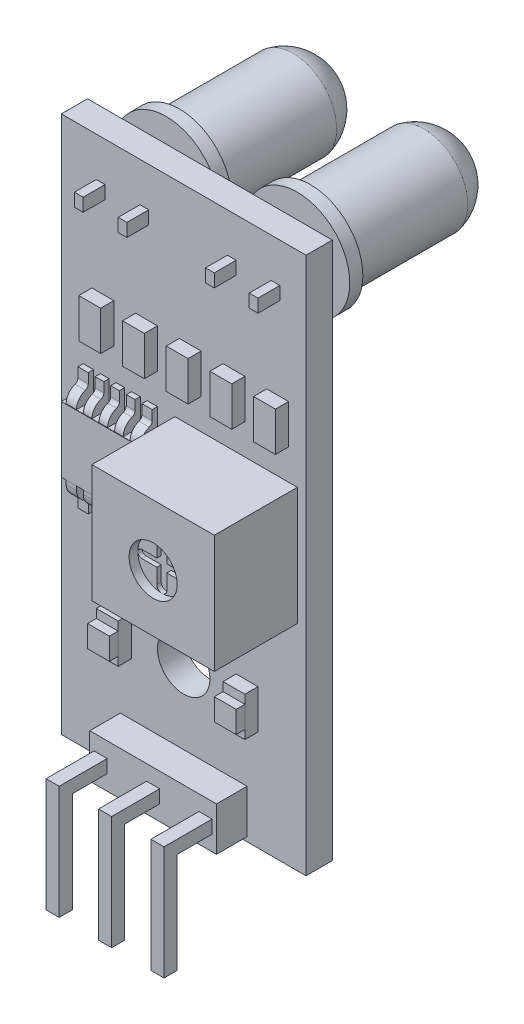
from build123d import *

# Parameters (mm, degrees)
SKETCH1_W                 = 14.224
SKETCH1_H                 = 31.242
BOSS_EXTRUDE1_DEPTH       = 0.762
SKETCH2_W                 = 7.366
SKETCH2_H                 = 2.54
BOSS_EXTRUDE2_DEPTH       = 1.778
BOSS_EXTRUDE3_START       = -4.318
SKETCH5_W                 = 0.762
SKETCH5_H                 = 0.762
BOSS_EXTRUDE3_DEPTH       = 6.35
SKETCH6_W                 = 0.762
SKETCH6_H                 = 0.762
BOSS_EXTRUDE4_DEPTH       = 6.604
LPATTERN1_COUNT           = 3
LPATTERN1_PITCH           = 3.048
CUT_EXTRUDE2_DEPTH        = 23.008773887
CUT_EXTRUDE2_DEPTH_BACK   = 23.008773887
SKETCH8_R                 = 1.524
SKETCH9_W                 = 1.27
SKETCH9_H                 = 2.286
BOSS_EXTRUDE5_DEPTH       = 0.762
SKETCH10_W                = 1.27
SKETCH10_H                = 1.27
BOSS_EXTRUDE6_DEPTH       = 0.508
LPATTERN2_START           = 3.048
LPATTERN2_OUTLINE_W       = 1.27
LPATTERN2_OUTLINE_H       = 0.508
LPATTERN2_DEPTH           = 1.27
LPATTERN2_START_2         = -9.779
LPATTERN2_2_OUTLINE_W     = 1.27
LPATTERN2_2_OUTLINE_H     = 0.762
LPATTERN2_2_DEPTH         = 2.286
SKETCH12_W                = 2.286
SKETCH12_H                = 1.27
BOSS_EXTRUDE7_DEPTH       = 0.762
LPATTERN3_COUNT           = 2
LPATTERN3_PITCH           = 5.842
SKETCH16_W                = 7.112
SKETCH16_H                = 6.858
BOSS_EXTRUDE9_DEPTH       = 4.826
SKETCH17_R                = 1.397
CUT_EXTRUDE3_DEPTH        = 0.508
CUT_EXTRUDE4_DEPTH        = 0.254
SKETCH19_W                = 1.27
SKETCH19_H                = 2.286
BOSS_EXTRUDE10_DEPTH      = 0.762
LPATTERN4_COUNT           = 5
LPATTERN4_PITCH           = 2.54
SKETCH31_W                = 4.826
SKETCH31_H                = 3.81
BOSS_EXTRUDE14_DEPTH      = 1.016
SKETCH32_W                = 4.318
SKETCH32_H                = 7.112
BOSS_EXTRUDE15_DEPTH      = 0.9906
SKETCH33_W                = 4.318
SKETCH33_H                = 0.762
CUT_EXTRUDE5_DEPTH        = 0.6858
FILLET4_R                 = 0.762
FILLET5_R                 = 0.254
BOSS_EXTRUDE16_START      = -2.54
SKETCH20_W                = 0.508
SKETCH20_H                = 0.762
BOSS_EXTRUDE16_DEPTH      = 3.81
LPATTERN6_COUNT           = 2
LPATTERN6_PITCH           = 2.54
LPATTERN9_COUNT           = 2
LPATTERN9_PITCH           = 7.62
LPATTERN9_START           = -2.54
LPATTERN9_COPY_1_SKETCH_W = 0.508
LPATTERN9_COPY_1_SKETCH_H = 0.762
LPATTERN9_COPY_1_DEPTH    = 3.81
CUT_EXTRUDE6_START        = -1.016
SKETCH38_W                = 0.4
SKETCH38_H                = 2.458537154
CUT_EXTRUDE6_DEPTH        = 0.9906


# Read off the part's stored shape, not the designer's step: LPattern2
with BuildPart() as part:
    # Sketch1 → Boss-Extrude1 (new, symmetric)
    with BuildSketch(Plane.XY):
        Rectangle(SKETCH1_W, SKETCH1_H)
    extrude(amount=BOSS_EXTRUDE1_DEPTH, both=True)

    # Sketch2 → Boss-Extrude2 (add)
    with BuildSketch(Plane.XY.offset(0.762)):
        with Locations((0, -14.097)):
            Rectangle(SKETCH2_W, SKETCH2_H)
    extrude(amount=BOSS_EXTRUDE2_DEPTH)

    # Sketch5 → Boss-Extrude3 (add)
    with BuildSketch(Plane.XY.offset(2.54).offset(BOSS_EXTRUDE3_START)):
        with Locations((-3.048, -14.097)):
            Rectangle(SKETCH5_W, SKETCH5_H)
    boss_extrude3 = extrude(amount=BOSS_EXTRUDE3_DEPTH)

    # Sketch6 → Boss-Extrude4 (add)
    with BuildSketch(Plane(origin=(0, -13.716, 0), x_dir=(1, 0, 0), z_dir=(0, 1, 0))):
        with Locations((-3.048, -4.953)):
            Rectangle(SKETCH6_W, SKETCH6_H)
    boss_extrude4 = extrude(amount=-BOSS_EXTRUDE4_DEPTH)

    # LPattern1: Boss-Extrude3, Boss-Extrude4 ×3
    with Locations(*[(i * LPATTERN1_PITCH, 0, 0) for i in range(1, LPATTERN1_COUNT)]):
        add(boss_extrude3)
        add(boss_extrude4)

    # Sketch8 → Cut-Extrude2 (cut, two sides: drawn at the far end of the back side and taken through both)
    with BuildSketch(Plane.XY.offset(0.762).offset(-CUT_EXTRUDE2_DEPTH_BACK)):
        with Locations(Location((0, -8.509, 0), (0, 0, 180))):
            Circle(SKETCH8_R)
    extrude(amount=CUT_EXTRUDE2_DEPTH + CUT_EXTRUDE2_DEPTH_BACK, mode=Mode.SUBTRACT)

    # Sketch9 → Boss-Extrude5 (add)
    with BuildSketch(Plane.XY.offset(0.762)):
        with Locations((-3.683, -8.636)):
            Rectangle(SKETCH9_W, SKETCH9_H)
    extrude(amount=BOSS_EXTRUDE5_DEPTH)

    # LPattern2 2 outline → LPattern2 2 (add)
    with BuildSketch(Plane(origin=(0, 0, 0), x_dir=(1, 0, 0), z_dir=(0, 1, 0)).offset(LPATTERN2_START_2)):
        with Locations((3.683, -1.143)):
            Rectangle(LPATTERN2_2_OUTLINE_W, LPATTERN2_2_OUTLINE_H)
    extrude(amount=LPATTERN2_2_DEPTH)

    # Sketch12 → Boss-Extrude7 (add)
    with BuildSketch(Plane.XY.offset(0.762)):
        with Locations((-2.921, -4.826)):
            Rectangle(SKETCH12_W, SKETCH12_H)
    boss_extrude7 = extrude(amount=BOSS_EXTRUDE7_DEPTH)

    # LPattern3: Boss-Extrude7 ×2
    with Locations(*[(i * LPATTERN3_PITCH, 0, 0) for i in range(1, LPATTERN3_COUNT)]):
        add(boss_extrude7)

    # Sketch16 → Boss-Extrude9 (add)
    with BuildSketch(Plane.XY.offset(0.762)):
        with Locations((3.048, 0.254)):
            Rectangle(SKETCH16_W, SKETCH16_H)
    extrude(amount=BOSS_EXTRUDE9_DEPTH)

    # Sketch17 → Cut-Extrude3 (cut)
    with BuildSketch(Plane.XY.offset(5.588)):
        with Locations((3.048, 0.127)):
            Circle(SKETCH17_R)
    extrude(amount=-CUT_EXTRUDE3_DEPTH, mode=Mode.SUBTRACT)

    # Sketch18 → Cut-Extrude4 (cut)
    with BuildSketch(Plane.XY.offset(5.08)):
        with BuildLine():
            Line((2.757000791, -0.979000791), (2.757000791, -0.102851416))
            Line((2.757000791, -0.102851416), (1.880851416, -0.102851416))
            ThreePointArc((1.880851416, -0.102851416), (1.651, 0.127), (1.880851416, 0.356851416))
            Line((1.880851416, 0.356851416), (2.757000791, 0.356851416))
            Line((2.757000791, 0.356851416), (2.757000791, 1.233000791))
            ThreePointArc((2.757000791, 1.233000791), (3.048, 1.524), (3.338999209, 1.233000791))
            Line((3.338999209, 1.233000791), (3.338999209, 0.356851416))
            Line((3.338999209, 0.356851416), (4.215148584, 0.356851416))
            ThreePointArc((4.215148584, 0.356851416), (4.445, 0.127), (4.215148584, -0.102851416))
            Line((4.215148584, -0.102851416), (3.338999209, -0.102851416))
            Line((3.338999209, -0.102851416), (3.338999209, -0.979000791))
            ThreePointArc((3.338999209, -0.979000791), (3.048, -1.27), (2.757000791, -0.979000791))
        make_face()
    extrude(amount=-CUT_EXTRUDE4_DEPTH, mode=Mode.SUBTRACT)

    # Sketch19 → Boss-Extrude10 (add)
    with BuildSketch(Plane.XY.offset(0.762)):
        with Locations((5.461, 6.604)):
            Rectangle(SKETCH19_W, SKETCH19_H)
    boss_extrude10 = extrude(amount=BOSS_EXTRUDE10_DEPTH)

    # LPattern4: Boss-Extrude10 ×5
    with Locations(*[(-i * LPATTERN4_PITCH, 0, 0) for i in range(1, LPATTERN4_COUNT)]):
        add(boss_extrude10)

    # Sketch31 → Boss-Extrude14 (add)
    with BuildSketch(Plane.XY.offset(0.762)):
        with Locations((-3.683, 0.254)):
            Rectangle(SKETCH31_W, SKETCH31_H)
    extrude(amount=BOSS_EXTRUDE14_DEPTH)

    # Sketch32 → Boss-Extrude15 (add)
    with BuildSketch(Plane.XY.offset(0.762)):
        with Locations((-3.683, 0.127)):
            Rectangle(SKETCH32_W, SKETCH32_H)
    extrude(amount=BOSS_EXTRUDE15_DEPTH)

    # Sketch33 → Cut-Extrude5 (cut)
    with BuildSketch(Plane.XY.offset(1.7526)):
        with Locations((-3.683, -3.048)):
            Rectangle(SKETCH33_W, SKETCH33_H)
        with Locations((-3.683, 3.302)):
            Rectangle(SKETCH33_W, SKETCH33_H)
    extrude(amount=-CUT_EXTRUDE5_DEPTH, mode=Mode.SUBTRACT)

    # Fillet4
    # the kernel refuses this fillet: 0.762 mm, written as the material it takes off along each edge
    with BuildSketch(Plane(origin=(0.371451068, 2.921, 1.7526), x_dir=(0, -1, 0), z_dir=(-1, 0, 0))) as fillet4_piece_1_section:
        with BuildLine():
            CenterArc((0.758180427, -0.762), FILLET4_R, 90, 84.260829523)
            Line((0, -0.6858), (0, 0))
            Line((0, 0), (0.758180427, 0))
        make_face()
    fillet4_piece_1 = extrude(amount=8.108902135, mode=Mode.PRIVATE)
    fillet4_piece_1 = split(fillet4_piece_1, bisect_by=Plane(origin=(-0.508, 2.675007043, 1.556844553), z_dir=(-1, 0, 0)), keep=Keep.TOP, mode=Mode.PRIVATE)
    add(fillet4_piece_1, mode=Mode.SUBTRACT)
    with BuildSketch(Plane(origin=(0.371451068, -2.667, 1.7526), x_dir=(0, 1, 0), z_dir=(-1, 0, 0))) as fillet4_piece_2_section:
        with BuildLine():
            CenterArc((0.758180427, 0.762), FILLET4_R, 185.739170477, 84.260829523)
            Line((0, 0.6858), (0, 0))
            Line((0, 0), (0.758180427, 0))
        make_face()
    fillet4_piece_2 = extrude(amount=8.108902135, mode=Mode.PRIVATE)
    fillet4_piece_2 = split(fillet4_piece_2, bisect_by=Plane(origin=(-0.508, -2.421007043, 1.556844553), z_dir=(-1, 0, 0)), keep=Keep.TOP, mode=Mode.PRIVATE)
    add(fillet4_piece_2, mode=Mode.SUBTRACT)

    # Fillet5
    fillet5_edges = [part.edges().sort_by_distance(p)[0] for p in [
        (-3.683, -2.667, 1.0668),
        (-3.683, 2.921, 1.0668),
    ]]
    fillet(fillet5_edges, radius=FILLET5_R)

    # Sketch20 → Boss-Extrude16 (add)
    with BuildSketch(Plane.XY.offset(0.762).offset(BOSS_EXTRUDE16_START)):
        with Locations((5.334, 12.954)):
            Rectangle(SKETCH20_W, SKETCH20_H)
    boss_extrude16 = extrude(amount=BOSS_EXTRUDE16_DEPTH)

    # LPattern6: Boss-Extrude16 ×2
    with Locations(*[(-i * LPATTERN6_PITCH, 0, 0) for i in range(1, LPATTERN6_COUNT)]):
        add(boss_extrude16)

    # Sketch37 → Revolve4 (revolve)
    with BuildSketch(Plane(origin=(0, 12.954, 0), x_dir=(1, 0, 0), z_dir=(0, 1, 0))):
        with BuildLine():
            Line((4.064, 1.778), (4.064, 11.176))
            ThreePointArc((4.064, 11.176), (5.701938499, 10.619923124), (6.604, 9.144))
            Line((6.604, 9.144), (6.604, 2.54))
            Line((6.604, 2.54), (7.112, 2.54))
            Line((7.112, 2.54), (7.112, 1.778))
            Line((7.112, 1.778), (4.064, 1.778))
        make_face()
    revolve4 = revolve(axis=Axis((4.064, 12.954, -1.778), (0, 0, -1)))

    # LPattern9: Boss-Extrude16, Revolve4 ×2
    with Locations(*[(-i * LPATTERN9_PITCH, 0, 0) for i in range(1, LPATTERN9_COUNT)]):
        add(boss_extrude16)
        add(revolve4)

    # LPattern9 copy 1 sketch → LPattern9 copy 1 (add)
    with BuildSketch(Plane(origin=(-10.16, 0, 0.762), x_dir=(1, 0, 0), z_dir=(0, 0, 1)).offset(LPATTERN9_START)):
        with Locations((5.334, 12.954)):
            Rectangle(LPATTERN9_COPY_1_SKETCH_W, LPATTERN9_COPY_1_SKETCH_H)
    extrude(amount=LPATTERN9_COPY_1_DEPTH)

    # Sketch38 → Cut-Extrude6 (cut)
    with BuildSketch(Plane.XY.offset(1.778).offset(CUT_EXTRUDE6_START)):
        with Locations((-5.042, 3.39208815)):
            Rectangle(SKETCH38_W, SKETCH38_H)
        with Locations((-2.324, -2.88408815)):
            Rectangle(SKETCH38_W, SKETCH38_H)
        with Locations((-4.136, 3.39208815)):
            Rectangle(SKETCH38_W, SKETCH38_H)
        with Locations((-3.23, 3.39208815)):
            Rectangle(SKETCH38_W, SKETCH38_H)
        with Locations((-2.324, 3.39208815)):
            Rectangle(SKETCH38_W, SKETCH38_H)
        with Locations((-3.23, -2.88408815)):
            Rectangle(SKETCH38_W, SKETCH38_H)
        with Locations((-4.136, -2.88408815)):
            Rectangle(SKETCH38_W, SKETCH38_H)
        with Locations((-5.042, -2.88408815)):
            Rectangle(SKETCH38_W, SKETCH38_H)
    extrude(amount=CUT_EXTRUDE6_DEPTH, mode=Mode.SUBTRACT)


with BuildPart() as body_2:
    # Sketch10 → Boss-Extrude6 (new body)
    with BuildSketch(Plane.XY.offset(1.524)):
        with Locations((-3.683, -8.636)):
            Rectangle(SKETCH10_W, SKETCH10_H)
    extrude(amount=BOSS_EXTRUDE6_DEPTH)


with BuildPart() as body_3:
    # LPattern2 outline → LPattern2 (new body)
    with BuildSketch(Plane.YZ.offset(LPATTERN2_START)):
        with Locations((-8.636, 1.778)):
            Rectangle(LPATTERN2_OUTLINE_W, LPATTERN2_OUTLINE_H)
    extrude(amount=LPATTERN2_DEPTH)


solid = Compound([part.part, body_2.part, body_3.part])
